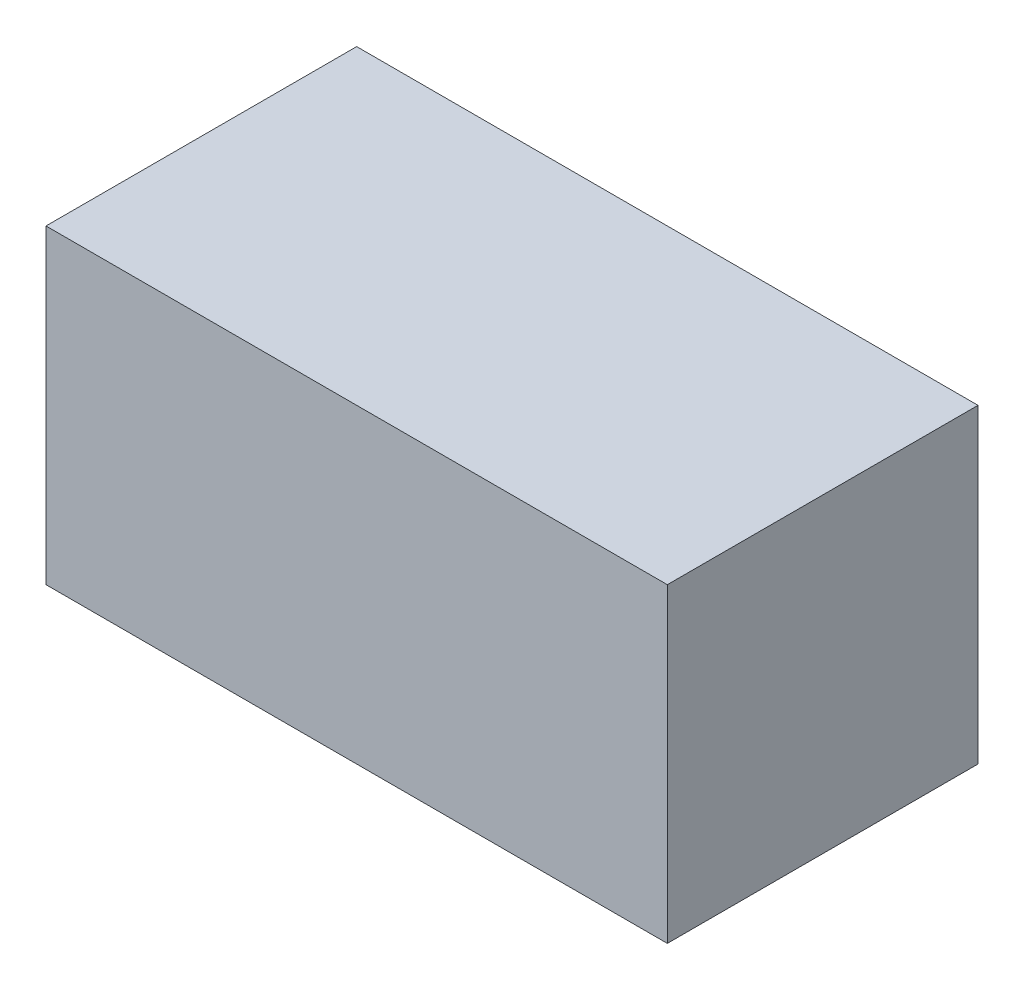
from build123d import *

# Parameters (mm, degrees)
SKETCH1_W           = 4
SKETCH1_H           = 4
BOSS_EXTRUDE1_DEPTH = 6
SKETCH2_W           = 4
SKETCH2_H           = 4
CUT_EXTRUDE1_DEPTH  = 8.483314774


with BuildPart() as part:
    # Sketch1 → Boss-Extrude1 (new, symmetric)
    with BuildSketch(Plane(origin=(0, 0, 0), x_dir=(0, 0, -1), z_dir=(1, 0, 0))):
        Rectangle(SKETCH1_W, SKETCH1_H)
    extrude(amount=BOSS_EXTRUDE1_DEPTH, both=True)

    # Sketch2 → Cut-Extrude1 (cut, through all)
    with BuildSketch(Plane(origin=(0, 2, 0), x_dir=(1, 0, 0), z_dir=(0, 1, 0))):
        with Locations((4, 0)):
            Rectangle(SKETCH2_W, SKETCH2_H)
    extrude(amount=-CUT_EXTRUDE1_DEPTH, mode=Mode.SUBTRACT)


solid = part.part
